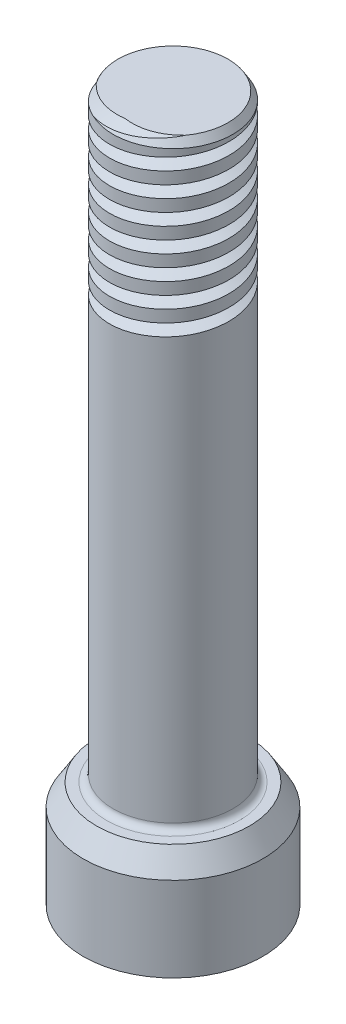
from build123d import *

# Parameters (mm, degrees)
CUT_SWEEP1_PITCH   = 1.27000254
CUT_EXTRUDE1_DEPTH = 3.048006096
FILLET1_R          = 0.355600711
FILLET2_R          = 0.396875794
CHAMFER3_SIZE      = 0.127


with BuildPart() as part:
    # Sketch1 → Revolve1 (revolve)
    with BuildSketch(Plane.XY, mode=Mode.PRIVATE) as revolve1_sk:
        Polygon((0, 0), (0, 38.1000762), (3.17500635, 38.1000762), (3.17500635, 6.3500127), (4.762509525, 6.3500127), (4.762509525, 0), align=None)
    revolve(revolve1_sk.sketch.rotate(Axis((0, 0, 0), (0, 1, 0)), 90), axis=Axis((0, 0, 0), (0, 1, 0)))

    # Cut-Sweep1: arcs per turn and ends read off the stored shape
    # Cut-Sweep1: the profile of Sketch3 profile screwed along a right-hand helix through 8.499986 turns, 8 arcs to a turn; built about Z, then put on its axis
    cut_sweep1_z = Axis((0, 0, 0), (0, 0, 1))
    cut_sweep1_corners = [(3.17530635, 0, -0.952351905), (3.17530635, 0, -1.587653175), (2.54000508, 0, -1.27000254)]
    with BuildLine(mode=Mode.PRIVATE) as cut_sweep1_profile:
        Line(cut_sweep1_corners[0], cut_sweep1_corners[1])
        Line(cut_sweep1_corners[1], cut_sweep1_corners[2])
        Line(cut_sweep1_corners[2], cut_sweep1_corners[0])
    cut_sweep1_cap = Face(cut_sweep1_profile.wire())
    cut_sweep1_turn_angles = [0, 22.5, 45, 67.5, 90, 112.5, 135, 157.5, 180, 202.5, 225, 247.5, 270, 292.5, 315, 337.5, 360]
    cut_sweep1_turn_weights = [1, 0.9238795325112867, 1, 0.9238795325112867, 1, 0.9238795325112867, 1, 0.9238795325112867, 1, 0.9238795325112867, 1, 0.9238795325112867, 1, 0.9238795325112867, 1, 0.9238795325112867, 1]
    cut_sweep1_turn_rails = [Edge.make_bspline([Vector(p[0], p[1], 0).rotate(cut_sweep1_z, cut_sweep1_turn_angles[k]) / cut_sweep1_turn_weights[k] + Vector(0, 0, p[2] + CUT_SWEEP1_PITCH * cut_sweep1_turn_angles[k] / 360) for k in range(17)], [0, 0, 0, 1, 1, 2, 2, 3, 3, 4, 4, 5, 5, 6, 6, 7, 7, 8, 8, 8], 2, cut_sweep1_turn_weights) for p in cut_sweep1_corners]
    cut_sweep1_turn_sides = [Face.make_surface_from_curves(cut_sweep1_turn_rails[p[0]], cut_sweep1_turn_rails[p[1]]) for p in [(0, 1), (1, 2), (2, 0)]]
    cut_sweep1_last_angles = [2880, 2902.5, 2925, 2947.5, 2970, 2992.5, 3015, 3037.4975, 3059.995]
    cut_sweep1_last_weights = [1, 0.9238795325112867, 1, 0.9238795325112867, 1, 0.9238795325112867, 1, 0.9238962293465327, 1]
    cut_sweep1_last_rails = [Edge.make_bspline([Vector(p[0], p[1], 0).rotate(cut_sweep1_z, cut_sweep1_last_angles[k]) / cut_sweep1_last_weights[k] + Vector(0, 0, p[2] + CUT_SWEEP1_PITCH * cut_sweep1_last_angles[k] / 360) for k in range(9)], [0, 0, 0, 1, 1, 2, 2, 3, 3, 4, 4, 4], 2, cut_sweep1_last_weights) for p in cut_sweep1_corners]
    cut_sweep1_last_sides = [Face.make_surface_from_curves(cut_sweep1_last_rails[p[0]], cut_sweep1_last_rails[p[1]]) for p in [(0, 1), (1, 2), (2, 0)]]
    cut_sweep1 = Plane(origin=(0, 38.1000762, 0), x_dir=(0, 0, 1), z_dir=(0, -1, 0)) * Solid(Shell([*[p.moved(Location((0, 0, CUT_SWEEP1_PITCH * i))) for i in range(8) for p in cut_sweep1_turn_sides], *cut_sweep1_last_sides, cut_sweep1_cap, cut_sweep1_cap.rotate(cut_sweep1_z, 3059.995).moved(Location((0, 0, CUT_SWEEP1_PITCH * 3059.995 / 360)))]))
    add(cut_sweep1, mode=Mode.SUBTRACT)

    # Sketch4 → Cut-Extrude1 (cut)
    with BuildSketch(Plane(origin=(0, 0, 0), x_dir=(1, 0, 0), z_dir=(0, 1, 0))):
        Polygon((0, 2.756968519), (-2.387604775, 1.37848426), (-2.387604775, -1.37848426), (0, -2.756968519), (2.387604775, -1.37848426), (2.387604775, 1.37848426), align=None)
    extrude(amount=CUT_EXTRUDE1_DEPTH, mode=Mode.SUBTRACT)

    # Fillet1
    fillet1_edges = [part.edges().sort_by_distance(p)[0] for p in [
        (0, 6.3500127, 3.17500635),
    ]]
    fillet(fillet1_edges, radius=FILLET1_R)

    # Fillet2
    fillet2_edges = [part.edges().sort_by_distance(p)[0] for p in [
        (2.387604775, 1.524003048, -1.37848426),
        (0, 1.524003048, -2.756968519),
        (-2.387604775, 1.524003048, -1.37848426),
        (-2.387604775, 1.524003048, 1.37848426),
        (0, 1.524003048, 2.756968519),
        (2.387604775, 1.524003048, 1.37848426),
        (1.193802388, 3.048006096, -2.06772639),
        (-1.193802388, 3.048006096, -2.06772639),
        (-2.387604775, 3.048006096, 0),
        (-1.193802388, 3.048006096, 2.06772639),
        (1.193802388, 3.048006096, 2.06772639),
        (2.387604775, 3.048006096, 0),
    ]]
    fillet(fillet2_edges, radius=FILLET2_R)

    # Chamfer1: read off the stored shape, not the designer's step
    # Chamfer1 outline → Chamfer1 (revolve, cut)
    with BuildSketch(Plane.XY):
        Polygon((3.17500635, 38.1000762), (2.921005842, 38.1000762), (3.17500635, 37.688652479), align=None)
    revolve(axis=Axis((0, 0, 0), (0, 1, 0)), mode=Mode.SUBTRACT)

    # Chamfer2: read off the stored shape, not the designer's step
    # Chamfer2 outline → Chamfer2 (revolve, cut)
    with BuildSketch(Plane.XY):
        Polygon((3.610523106, 0), (4.762509525, 0), (4.762509525, 0.711201422), align=None)
        Polygon((4.051308103, 6.3500127), (4.762509525, 5.198026281), (4.762509525, 6.3500127), align=None)
    revolve(axis=Axis((0, 0, 0), (0, 1, 0)), mode=Mode.SUBTRACT)

    # Chamfer3
    chamfer3_edges = [part.edges().sort_by_distance(p)[0] for p in [
        (1.193802388, 0, -2.06772639),
        (-1.193802388, 0, -2.06772639),
        (-2.387604775, 0, 0),
        (-1.193802388, 0, 2.06772639),
        (1.193802388, 0, 2.06772639),
        (2.387604775, 0, 0),
        (2.334433501, 0, -1.34778581),
        (2.334433501, 0, 1.34778581),
        (0, 0, 2.69557162),
        (-2.334433501, 0, 1.34778581),
        (-2.334433501, 0, -1.34778581),
        (0, 0, -2.69557162),
    ]]
    chamfer(chamfer3_edges, length=CHAMFER3_SIZE)


solid = part.part
